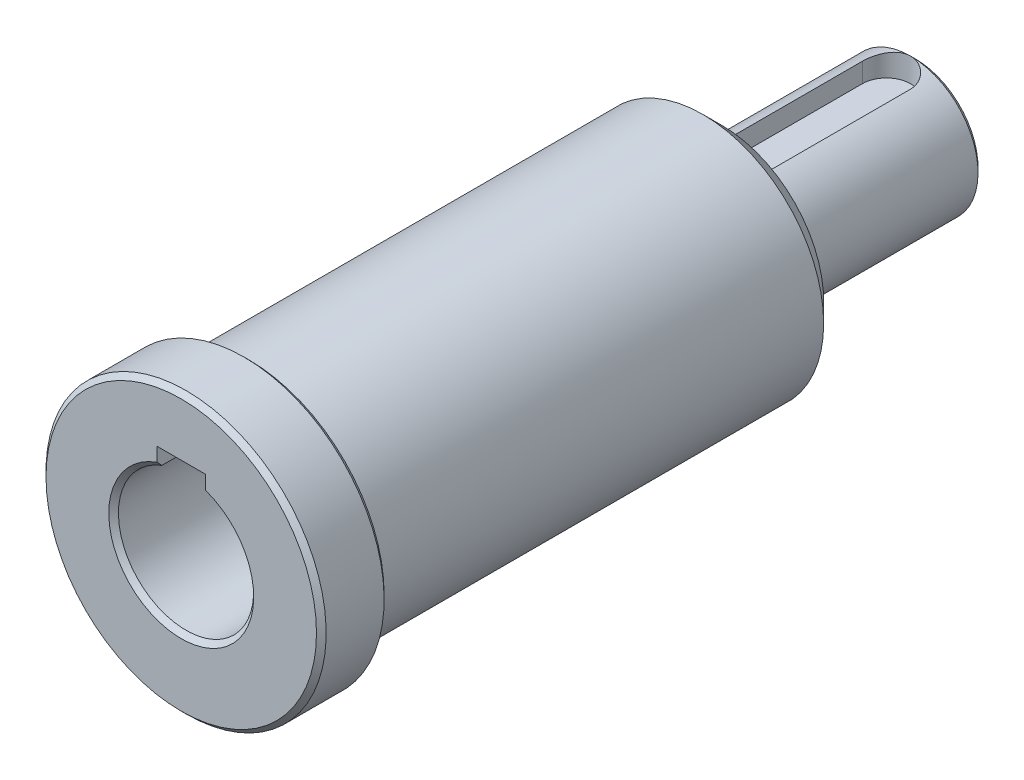
from build123d import *

# Parameters (mm, degrees)
FILLET_1_R          = 1
CHAMFER_1_SIZE      = 0.5
CHAMFER_2_SIZE      = 2
SKETCH_4_W          = 5
SKETCH_4_H          = 8.5
CUT_EXTRUDE_1_DEPTH = 30
CUT_EXTRUDE_2_DEPTH = 80.669630349


with BuildPart() as part:
    # 草图1 → 旋转1 (revolve)
    with BuildSketch(Plane(origin=(0, 0, 0), x_dir=(0, 0, -1), z_dir=(1, 0, 0))):
        Polygon((0, 0), (0, 14.5), (7, 14.5), (7, 12.5), (56, 12.5), (56, 6.98), (76, 6.98), (76, 0), align=None)
    revolve(axis=Axis((0, 0, -76), (0, 0, 1)))

    # 草图3 → 切除-旋转1 (revolve, cut)
    with BuildSketch(Plane(origin=(0, 0, 0), x_dir=(0, 0, -1), z_dir=(1, 0, 0))):
        Polygon((0, 0), (0, 7), (33.5, 7), (33.5, 2.75), (76, 2.75), (76, 0), align=None)
    revolve(axis=Axis((0, 0, -76), (0, 0, 1)), mode=Mode.SUBTRACT)

    # 圆角1
    fillet_1_edges = [part.edges().sort_by_distance(p)[0] for p in [
        (0, -7, -33.5),
    ]]
    fillet(fillet_1_edges, radius=FILLET_1_R)

    # 倒角1
    chamfer_1_edges = [part.edges().sort_by_distance(p)[0] for p in [
        (0, -2.75, -76),
        (0, -6.98, -76),
        (0, -14.5, 0),
        (0, -7, 0),
        (0, -14.5, -7),
        (0, -2.75, -33.5),
    ]]
    chamfer(chamfer_1_edges, length=CHAMFER_1_SIZE)

    # 倒角2
    chamfer_2_edges = [part.edges().sort_by_distance(p)[0] for p in [
        (0, -12.5, -56),
    ]]
    chamfer(chamfer_2_edges, length=CHAMFER_2_SIZE)

    # 草图4 → 切除-拉伸1 (cut)
    with BuildSketch(Plane.XY):
        with Locations((0, 4.25)):
            Rectangle(SKETCH_4_W, SKETCH_4_H)
    extrude(amount=-CUT_EXTRUDE_1_DEPTH, mode=Mode.SUBTRACT)

    # 草图5 → 切除-拉伸2 (cut, through all)
    with BuildSketch(Plane(origin=(0, 4.5, 0), x_dir=(1, 0, 0), z_dir=(0, 1, 0))):
        with BuildLine():
            Line((2.5, 73), (2.5, 58.5))
            ThreePointArc((2.5, 58.5), (0, 56), (-2.5, 58.5))
            Line((-2.5, 58.5), (-2.5, 73))
            ThreePointArc((-2.5, 73), (0, 75.5), (2.5, 73))
        make_face()
    extrude(amount=CUT_EXTRUDE_2_DEPTH, mode=Mode.SUBTRACT)


solid = part.part
